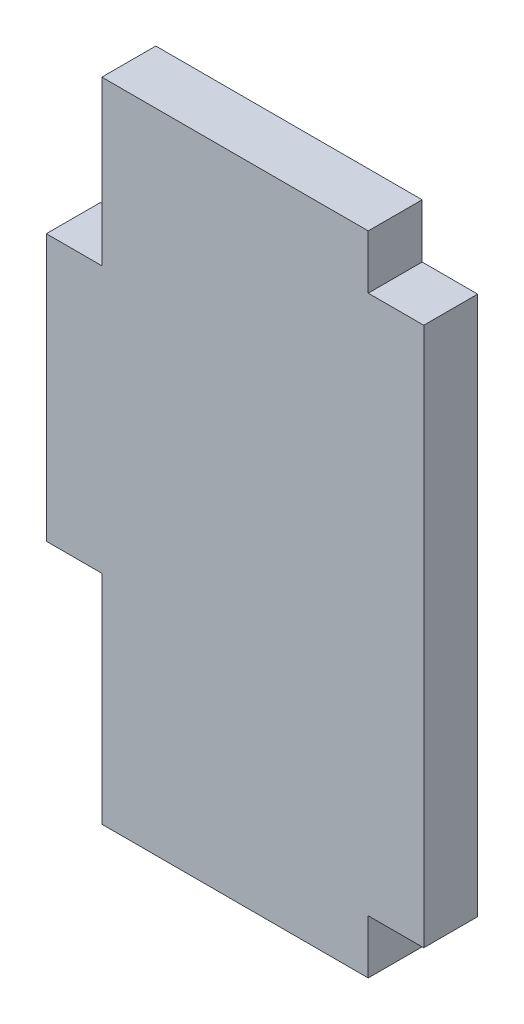
from build123d import *

# Parameters (mm, degrees)
BOSS_EXTRUDE1_DEPTH = 5


with BuildPart() as part:
    # Sketch1 → Boss-Extrude1 (new body)
    with BuildSketch(Plane.XY):
        Polygon((-5.15, 44.85), (0, 44.85), (0, 60), (24.7, 60), (24.7, 55), (29.85, 55), (29.85, 5), (24.7, 5), (24.7, 0), (0, 0), (0, 20.15), (-5.15, 20.15), align=None)
    extrude(amount=BOSS_EXTRUDE1_DEPTH)


solid = part.part
